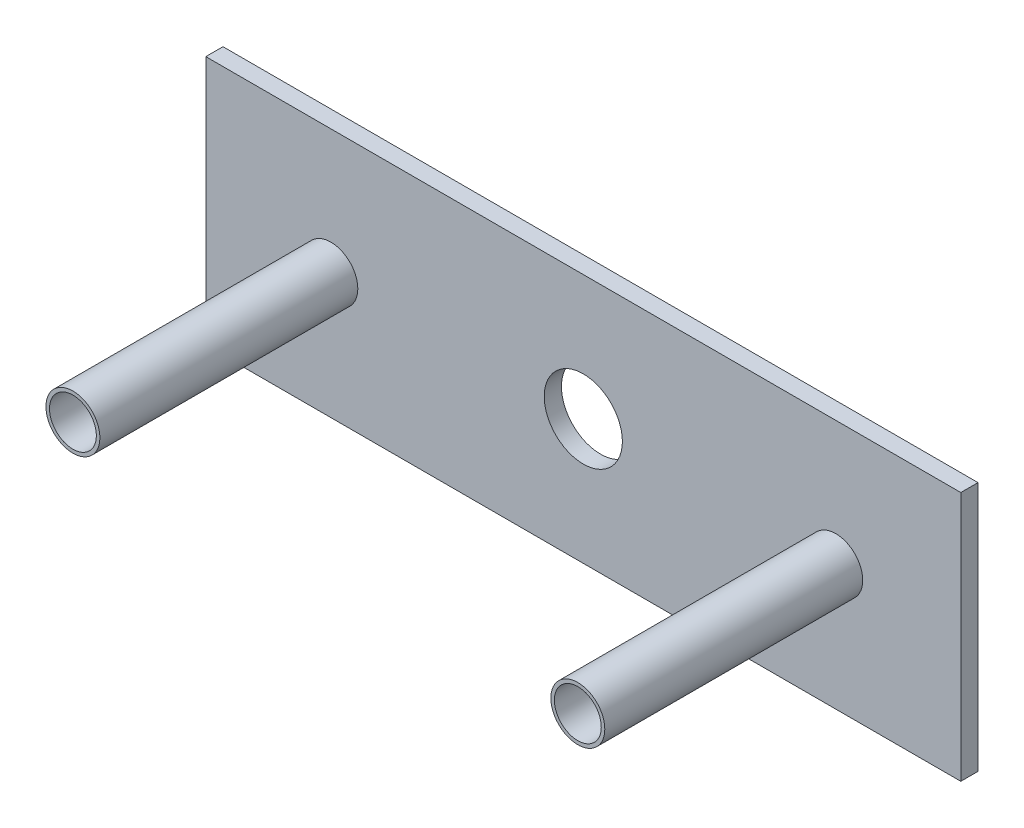
from build123d import *

# Parameters (mm, degrees)
ESQUISSE1_W             = 96.6
ESQUISSE1_H             = 32
BOSS_EXTRU_1_DEPTH      = 2.2
ESQUISSE6_R             = 3.45
BOSS_EXTRU_2_DEPTH      = 33
ESQUISSE7_R             = 3
ESQUISSE7_R_2           = 5
ENL_V_MAT_EXTRU_1_DEPTH = 64.013010851


with BuildPart() as part:
    # Esquisse1 → Boss.-Extru.1 (new body)
    with BuildSketch(Plane.XY):
        with Locations((0.671156739, 2.259938231)):
            Rectangle(ESQUISSE1_W, ESQUISSE1_H)
    extrude(amount=BOSS_EXTRU_1_DEPTH)

    # Esquisse6 → Boss.-Extru.2 (add)
    with BuildSketch(Plane.XY.offset(2.2)):
        with Locations((-31.628843261, 2.259938231)):
            Circle(ESQUISSE6_R)
        with Locations((32.971156739, 2.259938231)):
            Circle(ESQUISSE6_R)
    extrude(amount=BOSS_EXTRU_2_DEPTH)

    # Esquisse7 → Enlèv. mat.-Extru.1 (cut, through all)
    with BuildSketch(Plane.XY.offset(35.2)):
        with Locations((-31.628843261, 2.259938231)):
            Circle(ESQUISSE7_R)
        with Locations((32.971156739, 2.259938231)):
            Circle(ESQUISSE7_R)
        with Locations((0.671156739, 2.259938231)):
            Circle(ESQUISSE7_R_2)
    extrude(amount=-ENL_V_MAT_EXTRU_1_DEPTH, mode=Mode.SUBTRACT)


solid = part.part
